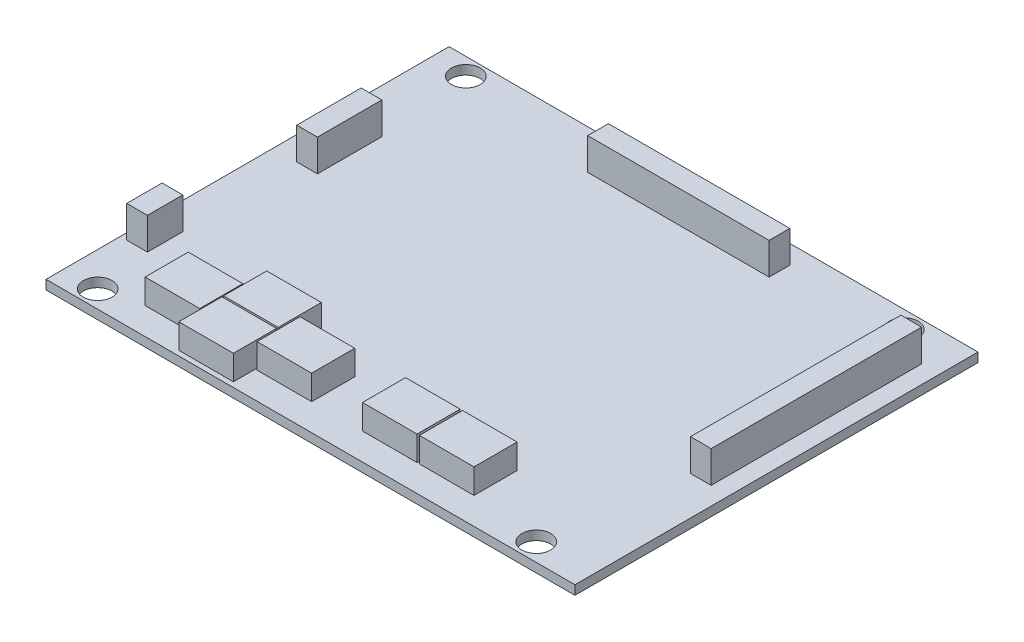
from build123d import *

# Parameters (mm, degrees)
SKETCH1_W             = 92
SKETCH1_H             = 70.1
SKETCH1_R             = 2.5
Y_PCB_EXTR_DEPTH      = 1.6
SKETCH2_W             = 31.55
SKETCH2_H             = 3.6
SKETCH2_W_2           = 3.6
SKETCH2_H_2           = 11.2
SKETCH2_H_3           = 6.15
SKETCH2_H_4           = 36.6
Y_HEADERS_EXTR_DEPTH  = 5.54
SKETCH3_W             = 9.5
SKETCH3_H             = 7.5
Y_SWITCHES_EXTR_DEPTH = 4.3
SKETCH4_W             = 7.4
SKETCH4_H             = 10.4
Y_U4_EXTR_DEPTH       = 2.6


with BuildPart() as part:
    # Sketch1 → Y+ PCB extr (new body)
    with BuildSketch(Plane(origin=(0, 0, 0), x_dir=(1, 0, 0), z_dir=(0, 1, 0))):
        with Locations((46, 35.05)):
            Rectangle(SKETCH1_W, SKETCH1_H)
        with Locations((5.92, 3.07)):
            Circle(SKETCH1_R, mode=Mode.SUBTRACT)
        with Locations((82.16, 3.11)):
            Circle(SKETCH1_R, mode=Mode.SUBTRACT)
        with Locations((82.16, 67.05)):
            Circle(SKETCH1_R, mode=Mode.SUBTRACT)
        with Locations((5.92, 67.1)):
            Circle(SKETCH1_R, mode=Mode.SUBTRACT)
    extrude(amount=Y_PCB_EXTR_DEPTH)

    # Sketch2 → Y+ headers extr (add)
    with BuildSketch(Plane(origin=(0, 1.6, 0), x_dir=(1, 0, 0), z_dir=(0, 1, 0))):
        with Locations((46.775, 65.02)):
            Rectangle(SKETCH2_W, SKETCH2_H)
        with Locations((5.92, 45.09)):
            Rectangle(SKETCH2_W_2, SKETCH2_H_2)
        with Locations((2.92, 15.995)):
            Rectangle(SKETCH2_W_2, SKETCH2_H_3)
        with Locations((87.08, 45.11)):
            Rectangle(SKETCH2_W_2, SKETCH2_H_4)
    extrude(amount=Y_HEADERS_EXTR_DEPTH)

    # Sketch3 → Y+ switches extr (add)
    with BuildSketch(Plane(origin=(0, 1.6, 0), x_dir=(1, 0, 0), z_dir=(0, 1, 0))):
        with Locations((17.32, 8.42)):
            Rectangle(SKETCH3_W, SKETCH3_H)
        with Locations((26.98, 4.61)):
            Rectangle(SKETCH3_W, SKETCH3_H)
        with Locations((26.98, 12.41)):
            Rectangle(SKETCH3_W, SKETCH3_H)
        with Locations((36.78, 8.42)):
            Rectangle(SKETCH3_W, SKETCH3_H)
        with Locations((55.12, 8.42)):
            Rectangle(SKETCH3_W, SKETCH3_H)
        with Locations((65.02, 8.42)):
            Rectangle(SKETCH3_W, SKETCH3_H)
    extrude(amount=Y_SWITCHES_EXTR_DEPTH)

    # Sketch4 → Y- U4 extr (add)
    with BuildSketch(Plane.XZ):
        with Locations((77.84, -14.6)):
            Rectangle(SKETCH4_W, SKETCH4_H)
    extrude(amount=Y_U4_EXTR_DEPTH)


solid = part.part
